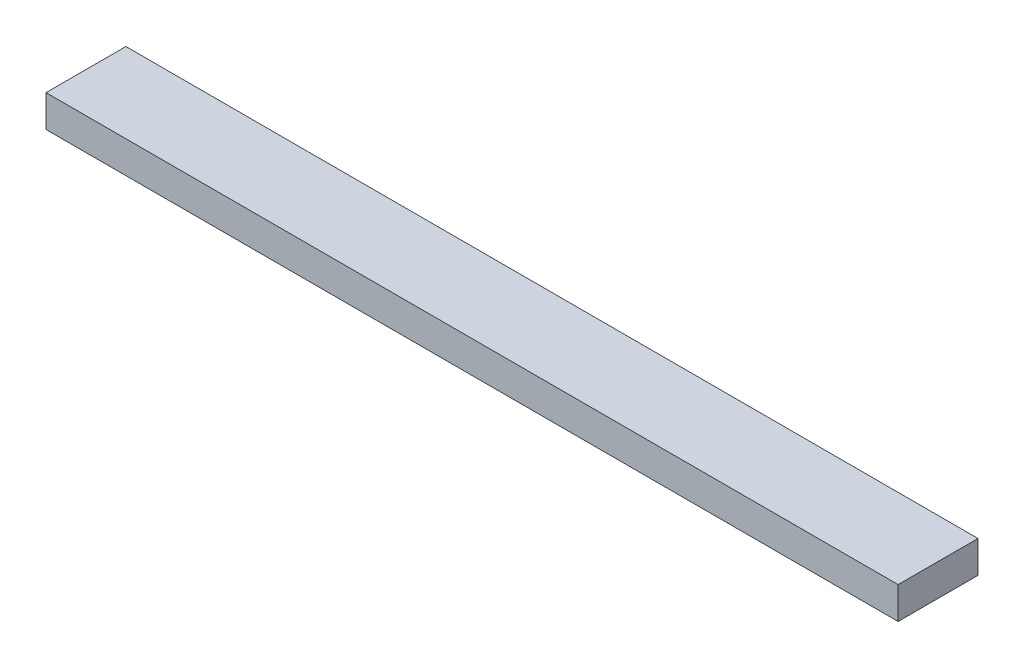
from build123d import *

# Parameters (mm, degrees)
SKETCH2_W           = 160
SKETCH2_H           = 15
BOSS_EXTRUDE1_DEPTH = 6


with BuildPart() as part:
    # Sketch2 → Boss-Extrude1 (new body)
    with BuildSketch(Plane(origin=(0, 0, 0), x_dir=(1, 0, 0), z_dir=(0, 1, 0))):
        Rectangle(SKETCH2_W, SKETCH2_H)
    extrude(amount=BOSS_EXTRUDE1_DEPTH)


solid = part.part
